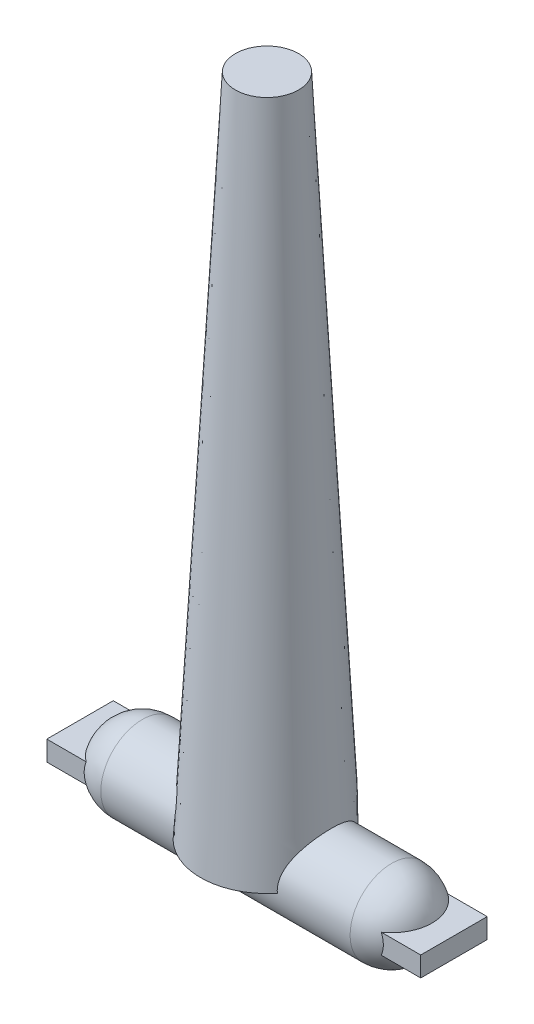
from build123d import *

# Parameters (mm, degrees)
SKETCH3_R           = 3.175
BOSS_EXTRUDE1_DEPTH = 12.7
FILLET1_R           = 3.175
SKETCH4_W           = 5.08
SKETCH4_H           = 1.524
BOSS_EXTRUDE2_DEPTH = 14.2875


with BuildPart() as part:
    # Sketch1 → Revolve1 (revolve)
    with BuildSketch(Plane.XY):
        Polygon((0, 50.8), (0, 0), (5.075315188, 0), (2.413, 50.8), align=None)
    revolve(axis=Axis((0, 50.8, 0), (0, -1, 0)))

    # Sketch3 → Boss-Extrude1 (add, symmetric)
    with BuildSketch(Plane(origin=(0, 0, 0), x_dir=(0, 0, -1), z_dir=(1, 0, 0))):
        Circle(SKETCH3_R)
    extrude(amount=BOSS_EXTRUDE1_DEPTH, both=True)

    # Fillet1
    fillet1_edges = [part.edges().sort_by_distance(p)[0] for p in [
        (-12.7, 0, 3.175),
        (12.7, 0, 3.175),
    ]]
    fillet(fillet1_edges, radius=FILLET1_R)

    # Sketch4 → Boss-Extrude2 (add, symmetric)
    with BuildSketch(Plane(origin=(0, 0, 0), x_dir=(0, 0, -1), z_dir=(1, 0, 0))):
        Rectangle(SKETCH4_W, SKETCH4_H)
    extrude(amount=BOSS_EXTRUDE2_DEPTH, both=True)


solid = part.part
